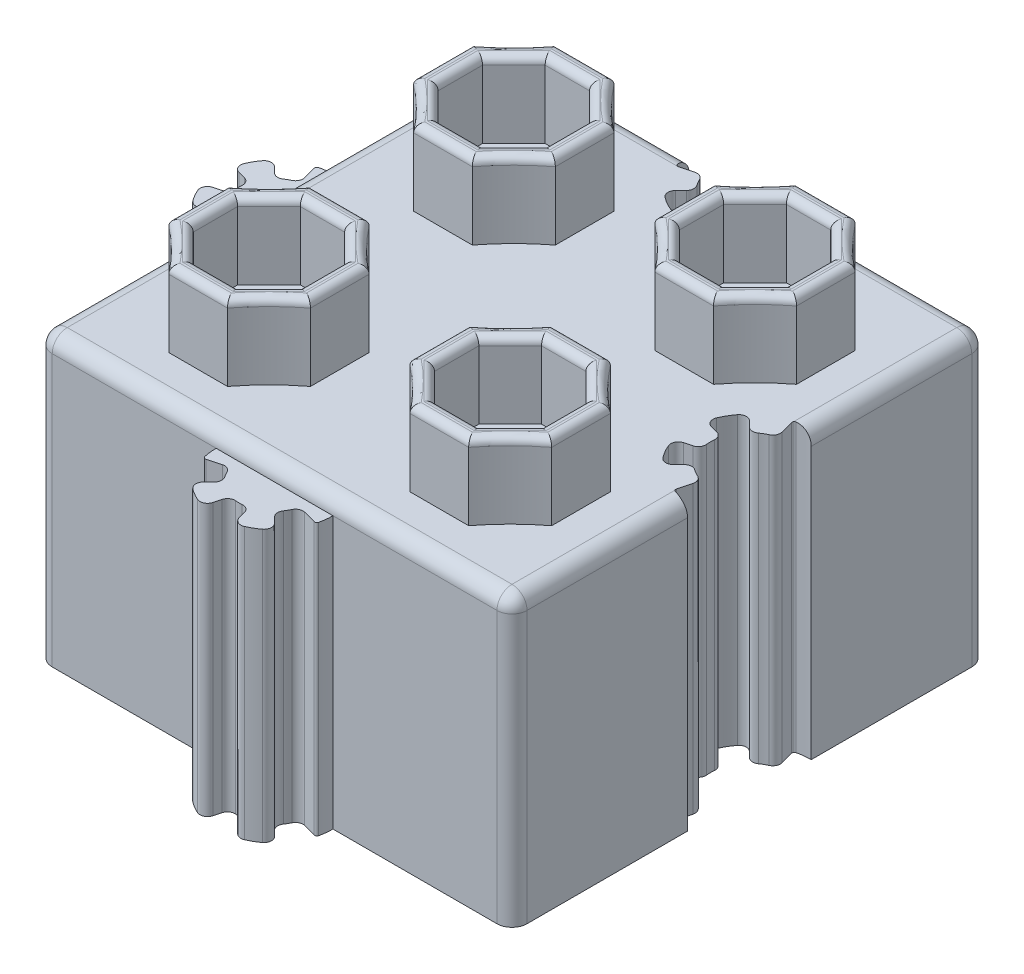
from build123d import *

# Parameters (mm, degrees)
SKETCH2_W                = 31.5
SKETCH2_H                = 31.5
BOSS_EXTRUDE1_DEPTH      = 19
CUT_EXTRUDE6_DEPTH       = 30.276697218
FILLET20_R               = 1
BOSS_EXTRUDE7_START      = -1
BOSS_EXTRUDE7_DEPTH      = 18
CUT_EXTRUDE13_DEPTH      = 2
CUT_EXTRUDE13_DEPTH_BACK = 1.5
BOSS_EXTRUDE11_DEPTH     = 5
FILLET33_R               = 0.5
CUT_EXTRUDE14_DEPTH      = 15
SKETCH18_W               = 1.2
SKETCH18_H               = 1.5
CUT_EXTRUDE15_DEPTH      = 0.025
CUT_EXTRUDE16_START      = -1.5
CUT_EXTRUDE16_DEPTH      = 1.5
FILLET34_R               = 0.5
FILLET35_START           = -1
FILLET35_DEPTH           = 16
FILLET42_R               = 0.5
FILLET43_R               = 0.15


with BuildPart() as part:
    # Sketch2 → Boss-Extrude1 (new body)
    with BuildSketch(Plane(origin=(0, 0, 0), x_dir=(1, 0, 0), z_dir=(0, 1, 0))):
        Rectangle(SKETCH2_W, SKETCH2_H)
    extrude(amount=BOSS_EXTRUDE1_DEPTH)

    # Sketch5 → Cut-Extrude6 (cut, through all)
    with BuildSketch(Plane(origin=(0, 19, 0), x_dir=(1, 0, 0), z_dir=(0, 1, 0))):
        with BuildLine():
            ThreePointArc((-0.647047613, 13.335185434), (0, 13.25), (0.647047613, 13.335185434))
            Line((0.647047613, 13.335185434), (1.03527618, 11.886296695))
            ThreePointArc((1.03527618, 11.886296695), (2, 12.285898385), (2.828427125, 12.921572875))
            Line((2.828427125, 12.921572875), (1.767766953, 13.982233047))
            ThreePointArc((1.767766953, 13.982233047), (2.165063509, 14.5), (2.414814566, 15.102952387))
            Line((2.414814566, 15.102952387), (3.863703305, 14.71472382))
            ThreePointArc((3.863703305, 14.71472382), (3.965779445, 15.227895231), (4, 15.75))
            Line((4, 15.75), (0, 15.75))
            Line((0, 15.75), (-4, 15.75))
            ThreePointArc((-4, 15.75), (-3.965779445, 15.227895231), (-3.863703305, 14.71472382))
            Line((-3.863703305, 14.71472382), (-2.414814566, 15.102952387))
            ThreePointArc((-2.414814566, 15.102952387), (-2.165063509, 14.5), (-1.767766953, 13.982233047))
            Line((-1.767766953, 13.982233047), (-2.828427125, 12.921572875))
            ThreePointArc((-2.828427125, 12.921572875), (-2, 12.285898385), (-1.03527618, 11.886296695))
            Line((-1.03527618, 11.886296695), (-0.647047613, 13.335185434))
        make_face()
        with BuildLine():
            Line((15.75, 2.6), (15.75, 4.1))
            ThreePointArc((15.75, 4.1), (15.214842612, 4.064923932), (14.688841915, 3.960295888))
            Line((14.688841915, 3.960295888), (15.077070483, 2.511407148))
            ThreePointArc((15.077070483, 2.511407148), (14.45, 2.25166605), (13.911522369, 1.838477631))
            Line((13.911522369, 1.838477631), (12.850862197, 2.899137803))
            ThreePointArc((12.850862197, 2.899137803), (12.199295844, 2.05), (11.789704112, 1.061158085))
            Line((11.789704112, 1.061158085), (13.238592852, 0.672929517))
            ThreePointArc((13.238592852, 0.672929517), (13.15, 0), (13.238592852, -0.672929517))
            Line((13.238592852, -0.672929517), (11.789704112, -1.061158085))
            ThreePointArc((11.789704112, -1.061158085), (12.199295844, -2.05), (12.850862197, -2.899137803))
            Line((12.850862197, -2.899137803), (13.911522369, -1.838477631))
            ThreePointArc((13.911522369, -1.838477631), (14.45, -2.25166605), (15.077070483, -2.511407148))
            Line((15.077070483, -2.511407148), (14.688841915, -3.960295888))
            ThreePointArc((14.688841915, -3.960295888), (15.214842612, -4.064923932), (15.75, -4.1))
            Line((15.75, -4.1), (15.75, -2.6))
            Line((15.75, -2.6), (15.75, 2.6))
        make_face()
    extrude(amount=-CUT_EXTRUDE6_DEPTH, mode=Mode.SUBTRACT)

    # Fillet20
    fillet20_edges = [part.edges().sort_by_distance(p)[0] for p in [
        (-15.75, 19, 0),
        (0, 19, 15.75),
        (15.75, 19, -9.925),
        (-9.875, 19, -15.75),
        (15.75, 19, 9.925),
        (15.75, 9.5, 15.75),
        (-15.75, 9.5, 15.75),
        (-15.75, 9.5, -15.75),
        (15.75, 9.5, -15.75),
        (9.875, 19, -15.75),
    ]]
    fillet(fillet20_edges, radius=FILLET20_R)

    # Sketch6 → Boss-Extrude7 (add, through all)
    with BuildSketch(Plane(origin=(0, 19, 0), x_dir=(1, 0, 0), z_dir=(0, 1, 0)).offset(BOSS_EXTRUDE7_START)):
        with BuildLine():
            Line((-3.742962577, -16.7529238), (-2.294073837, -16.364695232))
            ThreePointArc((-2.294073837, -16.364695232), (-2.056810334, -16.9375), (-1.679378605, -17.429378605))
            Line((-1.679378605, -17.429378605), (-2.740038777, -18.490038777))
            ThreePointArc((-2.740038777, -18.490038777), (-1.941459281, -19.103559431), (-1.011756018, -19.490584815))
            Line((-1.011756018, -19.490584815), (-0.620108527, -18.0426165))
            ThreePointArc((-0.620108527, -18.0426165), (0, -18.125), (0.620108527, -18.0426165))
            Line((0.620108527, -18.0426165), (1.011756018, -19.490584815))
            ThreePointArc((1.011756018, -19.490584815), (1.941459281, -19.103559431), (2.740038777, -18.490038777))
            Line((2.740038777, -18.490038777), (1.679378605, -17.429378605))
            ThreePointArc((1.679378605, -17.429378605), (2.056810334, -16.9375), (2.294073837, -16.364695232))
            Line((2.294073837, -16.364695232), (3.742962577, -16.7529238))
            ThreePointArc((3.742962577, -16.7529238), (3.841848838, -16.255788995), (3.875, -15.75))
            Line((3.875, -15.75), (-3.875, -15.75))
            ThreePointArc((-3.875, -15.75), (-3.841848838, -16.255788995), (-3.742962577, -16.7529238))
        make_face()
        with BuildLine():
            Line((-15.75, -3.875), (-15.75, 3.875))
            ThreePointArc((-15.75, 3.875), (-16.255788995, 3.841848838), (-16.7529238, 3.742962577))
            Line((-16.7529238, 3.742962577), (-16.364695232, 2.294073837))
            ThreePointArc((-16.364695232, 2.294073837), (-16.9375, 2.056810334), (-17.429378605, 1.679378605))
            Line((-17.429378605, 1.679378605), (-18.490038777, 2.740038777))
            ThreePointArc((-18.490038777, 2.740038777), (-19.10584844, 1.9375), (-19.492962577, 1.0029238))
            Line((-19.492962577, 1.0029238), (-18.044073837, 0.614695232))
            ThreePointArc((-18.044073837, 0.614695232), (-18.125, 0), (-18.044073837, -0.614695232))
            Line((-18.044073837, -0.614695232), (-19.492962577, -1.0029238))
            ThreePointArc((-19.492962577, -1.0029238), (-19.10584844, -1.9375), (-18.490038777, -2.740038777))
            Line((-18.490038777, -2.740038777), (-17.429378605, -1.679378605))
            ThreePointArc((-17.429378605, -1.679378605), (-16.9375, -2.056810334), (-16.364695232, -2.294073837))
            Line((-16.364695232, -2.294073837), (-16.7529238, -3.742962577))
            ThreePointArc((-16.7529238, -3.742962577), (-16.255788995, -3.841848838), (-15.75, -3.875))
        make_face()
    extrude(amount=-BOSS_EXTRUDE7_DEPTH)

    # Sketch16 → Cut-Extrude13 (cut, two sides: drawn at the far end of the back side and taken through both)
    with BuildSketch(Plane.XZ.offset(-CUT_EXTRUDE13_DEPTH_BACK)):
        with BuildLine():
            Line((-14.3, 14.3), (-8.175, 14.3))
            Line((-8.175, 14.3), (-8.175, 12.6))
            ThreePointArc((-8.175, 12.6), (-8.145710678, 12.529289322), (-8.075, 12.5))
            Line((-8.075, 12.5), (-6.825, 12.5))
            ThreePointArc((-6.825, 12.5), (-6.754289322, 12.529289322), (-6.725, 12.6))
            Line((-6.725, 12.6), (-6.725, 14.3))
            Line((-6.725, 14.3), (6.721665956, 14.3))
            Line((6.721665956, 14.3), (6.721665956, 12.6))
            ThreePointArc((6.721665956, 12.6), (6.750955278, 12.529289322), (6.821665956, 12.5))
            Line((6.821665956, 12.5), (8.071665956, 12.5))
            ThreePointArc((8.071665956, 12.5), (8.142376634, 12.529289322), (8.171665956, 12.6))
            Line((8.171665956, 12.6), (8.171665956, 14.3))
            Line((8.171665956, 14.3), (14.3, 14.3))
            Line((14.3, 14.3), (14.3, 8.175))
            Line((14.3, 8.175), (12.6, 8.175))
            ThreePointArc((12.6, 8.175), (12.529289322, 8.145710678), (12.5, 8.075))
            Line((12.5, 8.075), (12.5, 6.825))
            ThreePointArc((12.5, 6.825), (12.529289322, 6.754289322), (12.6, 6.725))
            Line((12.6, 6.725), (14.3, 6.725))
            Line((14.3, 6.725), (14.3, 4.623310502))
            ThreePointArc((14.3, 4.623310502), (11.956404012, 3.135991924), (10.82799643, 0.6))
            ThreePointArc((10.82799643, 0.6), (10.782740417, 0), (10.82799643, -0.6))
            ThreePointArc((10.82799643, -0.6), (11.956404012, -3.135991924), (14.3, -4.623310502))
            Line((14.3, -4.623310502), (14.3, -6.725))
            Line((14.3, -6.725), (12.6, -6.725))
            ThreePointArc((12.6, -6.725), (12.529289322, -6.754289322), (12.5, -6.825))
            Line((12.5, -6.825), (12.5, -8.075))
            ThreePointArc((12.5, -8.075), (12.529289322, -8.145710678), (12.6, -8.175))
            Line((12.6, -8.175), (14.3, -8.175))
            Line((14.3, -8.175), (14.3, -14.3))
            Line((14.3, -14.3), (8.35038088, -14.3))
            Line((8.35038088, -14.3), (8.171665956, -14.3))
            Line((8.171665956, -14.3), (8.171665956, -12.6))
            ThreePointArc((8.171665956, -12.6), (8.142376634, -12.529289322), (8.071665956, -12.5))
            Line((8.071665956, -12.5), (6.821665956, -12.5))
            ThreePointArc((6.821665956, -12.5), (6.750955278, -12.529289322), (6.721665956, -12.6))
            Line((6.721665956, -12.6), (6.721665956, -14.3))
            Line((6.721665956, -14.3), (4.623310502, -14.3))
            Line((4.623310502, -14.3), (4.575751304, -14.3))
            ThreePointArc((4.575751304, -14.3), (3.072656017, -12.062346952), (0.600502286, -10.987710949))
            ThreePointArc((0.600502286, -10.987710949), (-0.001645996, -10.942336934), (-0.603763067, -10.988123252))
            ThreePointArc((-0.603763067, -10.988123252), (-3.073918375, -12.063399151), (-4.575751304, -14.3))
            Line((-4.575751304, -14.3), (-4.623310502, -14.3))
            Line((-4.623310502, -14.3), (-6.725, -14.3))
            Line((-6.725, -14.3), (-6.725, -12.6))
            ThreePointArc((-6.725, -12.6), (-6.754289322, -12.529289322), (-6.825, -12.5))
            Line((-6.825, -12.5), (-8.075, -12.5))
            ThreePointArc((-8.075, -12.5), (-8.145710678, -12.529289322), (-8.175, -12.6))
            Line((-8.175, -12.6), (-8.175, -14.3))
            Line((-8.175, -14.3), (-14.3, -14.3))
            Line((-14.3, -14.3), (-14.3, -8.175))
            Line((-14.3, -8.175), (-12.6, -8.175))
            ThreePointArc((-12.6, -8.175), (-12.529289322, -8.145710678), (-12.5, -8.075))
            Line((-12.5, -8.075), (-12.5, -6.825))
            ThreePointArc((-12.5, -6.825), (-12.529289322, -6.754289322), (-12.6, -6.725))
            Line((-12.6, -6.725), (-14.3, -6.725))
            Line((-14.3, -6.725), (-14.3, 6.725))
            Line((-14.3, 6.725), (-12.6, 6.725))
            ThreePointArc((-12.6, 6.725), (-12.529289322, 6.754289322), (-12.5, 6.825))
            Line((-12.5, 6.825), (-12.5, 8.075))
            ThreePointArc((-12.5, 8.075), (-12.529289322, 8.145710678), (-12.6, 8.175))
            Line((-12.6, 8.175), (-14.3, 8.175))
            Line((-14.3, 8.175), (-14.3, 14.3))
        make_face()
    extrude(amount=CUT_EXTRUDE13_DEPTH + CUT_EXTRUDE13_DEPTH_BACK, mode=Mode.SUBTRACT)

    # Sketch3 → Boss-Extrude11 (add)
    # profile 1 of 4: a face of its own
    with BuildSketch(Plane(origin=(0, 19, 0), x_dir=(1, 0, 0), z_dir=(0, 1, 0))):
        with BuildLine():
            ThreePointArc((-9.946803743, 3.421093296), (-11.233690264, 4.887403031), (-12.7, 6.174289552))
            Line((-12.7, 6.174289552), (-12.7, 10.067897039))
            ThreePointArc((-12.7, 10.067897039), (-11.233690264, 11.35478356), (-9.946803743, 12.821093296))
            Line((-9.946803743, 12.821093296), (-6.053196257, 12.821093296))
            ThreePointArc((-6.053196257, 12.821093296), (-4.766309736, 11.35478356), (-3.3, 10.067897039))
            Line((-3.3, 10.067897039), (-3.3, 6.174289552))
            ThreePointArc((-3.3, 6.174289552), (-4.766309736, 4.887403031), (-6.053196257, 3.421093296))
            Line((-6.053196257, 3.421093296), (-9.946803743, 3.421093296))
        make_face()
        Polygon((-9.470458146, 4.571093296), (-6.529541854, 4.571093296), (-4.45, 6.650635149), (-4.45, 9.591551442), (-6.529541854, 11.671093296), (-9.470458146, 11.671093296), (-11.55, 9.591551442), (-11.55, 6.650635149), align=None, mode=Mode.SUBTRACT)
    # profile 2 of 4: a face of its own
    with BuildSketch(Plane(origin=(0, 19, 0), x_dir=(1, 0, 0), z_dir=(0, 1, 0))):
        with BuildLine():
            Line((12.7, 10.067897039), (12.7, 6.174289552))
            ThreePointArc((12.7, 6.174289552), (11.233690264, 4.887403031), (9.946803743, 3.421093296))
            Line((9.946803743, 3.421093296), (6.053196257, 3.421093296))
            ThreePointArc((6.053196257, 3.421093296), (4.766309736, 4.887403031), (3.3, 6.174289552))
            Line((3.3, 6.174289552), (3.3, 10.067897039))
            ThreePointArc((3.3, 10.067897039), (4.766309736, 11.35478356), (6.053196257, 12.821093296))
            Line((6.053196257, 12.821093296), (9.946803743, 12.821093296))
            ThreePointArc((9.946803743, 12.821093296), (11.233690264, 11.35478356), (12.7, 10.067897039))
        make_face()
        Polygon((9.470458146, 4.571093296), (6.529541854, 4.571093296), (4.45, 6.650635149), (4.45, 9.591551442), (6.529541854, 11.671093296), (9.470458146, 11.671093296), (11.55, 9.591551442), (11.55, 6.650635149), align=None, mode=Mode.SUBTRACT)
    # profile 3 of 4: a face of its own
    with BuildSketch(Plane(origin=(0, 19, 0), x_dir=(1, 0, 0), z_dir=(0, 1, 0))):
        with BuildLine():
            ThreePointArc((9.946803743, -3.421093296), (11.233690264, -4.887403031), (12.7, -6.174289552))
            Line((12.7, -6.174289552), (12.7, -10.067897039))
            ThreePointArc((12.7, -10.067897039), (11.233690264, -11.35478356), (9.946803743, -12.821093296))
            Line((9.946803743, -12.821093296), (6.053196257, -12.821093296))
            ThreePointArc((6.053196257, -12.821093296), (4.766309736, -11.35478356), (3.3, -10.067897039))
            Line((3.3, -10.067897039), (3.3, -6.174289552))
            ThreePointArc((3.3, -6.174289552), (4.766309736, -4.887403031), (6.053196257, -3.421093296))
            Line((6.053196257, -3.421093296), (9.946803743, -3.421093296))
        make_face()
        Polygon((9.470458146, -4.571093296), (6.529541854, -4.571093296), (4.45, -6.650635149), (4.45, -9.591551442), (6.529541854, -11.671093296), (9.470458146, -11.671093296), (11.55, -9.591551442), (11.55, -6.650635149), align=None, mode=Mode.SUBTRACT)
    # profile 4 of 4: a face of its own
    with BuildSketch(Plane(origin=(0, 19, 0), x_dir=(1, 0, 0), z_dir=(0, 1, 0))):
        with BuildLine():
            Line((-12.7, -10.067897039), (-12.7, -6.174289552))
            ThreePointArc((-12.7, -6.174289552), (-11.233690264, -4.887403031), (-9.946803743, -3.421093296))
            Line((-9.946803743, -3.421093296), (-6.053196257, -3.421093296))
            ThreePointArc((-6.053196257, -3.421093296), (-4.766309736, -4.887403031), (-3.3, -6.174289552))
            Line((-3.3, -6.174289552), (-3.3, -10.067897039))
            ThreePointArc((-3.3, -10.067897039), (-4.766309736, -11.35478356), (-6.053196257, -12.821093296))
            Line((-6.053196257, -12.821093296), (-9.946803743, -12.821093296))
            ThreePointArc((-9.946803743, -12.821093296), (-11.233690264, -11.35478356), (-12.7, -10.067897039))
        make_face()
        Polygon((-9.470458146, -4.571093296), (-6.529541854, -4.571093296), (-4.45, -6.650635149), (-4.45, -9.591551442), (-6.529541854, -11.671093296), (-9.470458146, -11.671093296), (-11.55, -9.591551442), (-11.55, -6.650635149), align=None, mode=Mode.SUBTRACT)
    extrude(amount=BOSS_EXTRUDE11_DEPTH)

    # Fillet33
    fillet33_edges = [part.edges().sort_by_distance(p)[0] for p in [
        (-8, 24, -4.571093296),
        (-10.510229073, 24, -5.610864222),
        (-11.55, 24, -8.121093296),
        (-10.510229073, 24, -10.631322369),
        (-8, 24, -11.671093296),
        (-5.489770927, 24, -10.631322369),
        (-4.45, 24, -8.121093296),
        (-11.233690264, 24, -4.887403031),
        (-4.766309736, 24, -11.35478356),
        (-11.233690264, 24, -11.35478356),
        (-5.489770927, 24, -5.610864222),
        (-8, 24, -3.421093296),
        (-4.766309736, 24, -4.887403031),
        (-3.3, 24, -8.121093296),
        (-8, 24, -12.821093296),
        (-12.7, 24, -8.121093296),
        (12.7, 24, -8.121093296),
        (8, 24, -12.821093296),
        (3.3, 24, -8.121093296),
        (4.766309736, 24, -4.887403031),
        (8, 24, -3.421093296),
        (8, 24, -4.571093296),
        (5.489770927, 24, -5.610864222),
        (4.45, 24, -8.121093296),
        (5.489770927, 24, -10.631322369),
        (8, 24, -11.671093296),
        (10.510229073, 24, -10.631322369),
        (11.55, 24, -8.121093296),
        (10.510229073, 24, -5.610864222),
        (11.233690264, 24, -11.35478356),
        (4.766309736, 24, -11.35478356),
        (11.233690264, 24, -4.887403031),
        (8, 24, 4.571093296),
        (10.510229073, 24, 5.610864222),
        (11.55, 24, 8.121093296),
        (10.510229073, 24, 10.631322369),
        (8, 24, 11.671093296),
        (5.489770927, 24, 10.631322369),
        (4.45, 24, 8.121093296),
        (11.233690264, 24, 4.887403031),
        (4.766309736, 24, 11.35478356),
        (11.233690264, 24, 11.35478356),
        (5.489770927, 24, 5.610864222),
        (8, 24, 3.421093296),
        (4.766309736, 24, 4.887403031),
        (3.3, 24, 8.121093296),
        (8, 24, 12.821093296),
        (12.7, 24, 8.121093296),
        (-12.7, 24, 8.121093296),
        (-8, 24, 12.821093296),
        (-3.3, 24, 8.121093296),
        (-4.766309736, 24, 4.887403031),
        (-8, 24, 3.421093296),
        (-8, 24, 4.571093296),
        (-5.489770927, 24, 5.610864222),
        (-4.45, 24, 8.121093296),
        (-5.489770927, 24, 10.631322369),
        (-8, 24, 11.671093296),
        (-10.510229073, 24, 10.631322369),
        (-11.55, 24, 8.121093296),
        (-10.510229073, 24, 5.610864222),
        (-11.233690264, 24, 11.35478356),
        (-4.766309736, 24, 11.35478356),
        (-11.233690264, 24, 4.887403031),
    ]]
    fillet(fillet33_edges, radius=FILLET33_R)

    # Sketch7 → Cut-Extrude14 (cut)
    with BuildSketch(Plane.XZ):
        with BuildLine():
            ThreePointArc((-4.259988263, -14.3), (-2.859722023, -12.275523068), (-0.603763067, -11.290687255))
            Line((-0.603763067, -11.290687255), (-0.603763067, -4.963413156))
            ThreePointArc((-0.603763067, -4.963413156), (-1.845028292, -4.647135742), (-2.965202778, -4.025862949))
            Line((-2.965202778, -4.025862949), (-3.959797975, -5.020458146))
            Line((-3.959797975, -5.020458146), (-5.020458146, -3.959797975))
            Line((-5.020458146, -3.959797975), (-4.027923069, -2.962403712))
            ThreePointArc((-4.027923069, -2.962403712), (-4.64847513, -1.841651151), (-4.963869458, -0.6))
            Line((-4.963869458, -0.6), (-14.325, -0.6))
            Line((-14.325, -0.6), (-14.325, -6.725))
            Line((-14.325, -6.725), (-12.675, -6.725))
            Line((-12.675, -6.725), (-12.675, -7.3))
            Line((-12.675, -7.3), (-14.325, -7.3))
            Line((-14.325, -7.3), (-14.325, -14.3))
            Line((-14.325, -14.3), (-7.325, -14.3))
            Line((-7.325, -14.3), (-7.325, -12.65))
            Line((-7.325, -12.65), (-6.725, -12.65))
            Line((-6.725, -12.65), (-6.725, -14.3))
            Line((-6.725, -14.3), (-4.259988263, -14.3))
        make_face()
        with BuildLine():
            ThreePointArc((14.3, -4.259988263), (12.274316834, -2.858255854), (11.290179376, -0.6))
            Line((11.290179376, -0.6), (4.963869458, -0.6))
            ThreePointArc((4.963869458, -0.6), (4.64847513, -1.841651151), (4.027923069, -2.962403712))
            Line((4.027923069, -2.962403712), (5.020458146, -3.959797975))
            Line((5.020458146, -3.959797975), (3.959797975, -5.020458146))
            Line((3.959797975, -5.020458146), (2.965202778, -4.025862949))
            ThreePointArc((2.965202778, -4.025862949), (1.843266601, -4.64783479), (0.6, -4.963869458))
            Line((0.6, -4.963869458), (0.6, -11.290179376))
            ThreePointArc((0.6, -11.290179376), (2.86843208, -12.282710367), (4.268415983, -14.325))
            Line((4.268415983, -14.325), (6.7, -14.325))
            Line((6.7, -14.325), (6.7, -12.525))
            Line((6.7, -12.525), (7.3, -12.525))
            Line((7.3, -12.525), (7.3, -14.325))
            Line((7.3, -14.325), (14.3, -14.325))
            Line((14.3, -14.325), (14.3, -7.325))
            Line((14.3, -7.325), (12.65, -7.325))
            Line((12.65, -7.325), (12.65, -6.725))
            Line((12.65, -6.725), (14.3, -6.725))
            Line((14.3, -6.725), (14.3, -4.259988263))
        make_face()
        with BuildLine():
            Line((7.571665956, 14.3), (0.6, 14.3))
            Line((0.6, 14.3), (0.6, 4.963869458))
            ThreePointArc((0.6, 4.963869458), (1.843266601, 4.64783479), (2.965202778, 4.025862949))
            Line((2.965202778, 4.025862949), (3.959797975, 5.020458146))
            Line((3.959797975, 5.020458146), (5.020458146, 3.959797975))
            Line((5.020458146, 3.959797975), (4.027923069, 2.962403712))
            ThreePointArc((4.027923069, 2.962403712), (4.64847513, 1.841651151), (4.963869458, 0.6))
            Line((4.963869458, 0.6), (11.290179376, 0.6))
            ThreePointArc((11.290179376, 0.6), (12.274316834, 2.858255854), (14.3, 4.259988263))
            Line((14.3, 4.259988263), (14.3, 6.7))
            Line((14.3, 6.7), (12.5, 6.7))
            Line((12.5, 6.7), (12.5, 7.3))
            Line((12.5, 7.3), (14.3, 7.3))
            Line((14.3, 7.3), (14.3, 14.3))
            Line((14.3, 14.3), (8.171665956, 14.3))
            Line((8.171665956, 14.3), (8.171665956, 12.65))
            Line((8.171665956, 12.65), (7.571665956, 12.65))
            Line((7.571665956, 12.65), (7.571665956, 14.3))
        make_face()
        with BuildLine():
            Line((-7.325, 14.3), (-14.325, 14.3))
            Line((-14.325, 14.3), (-14.325, 7.3))
            Line((-14.325, 7.3), (-12.525, 7.3))
            Line((-12.525, 7.3), (-12.525, 6.7))
            Line((-12.525, 6.7), (-14.325, 6.7))
            Line((-14.325, 6.7), (-14.325, 0.6))
            Line((-14.325, 0.6), (-4.963869458, 0.6))
            ThreePointArc((-4.963869458, 0.6), (-4.64847513, 1.841651151), (-4.027923069, 2.962403712))
            Line((-4.027923069, 2.962403712), (-5.020458146, 3.959797975))
            Line((-5.020458146, 3.959797975), (-3.959797975, 5.020458146))
            Line((-3.959797975, 5.020458146), (-2.965202778, 4.025862949))
            ThreePointArc((-2.965202778, 4.025862949), (-1.845028292, 4.647135742), (-0.603763067, 4.963413156))
            Line((-0.603763067, 4.963413156), (-0.603763067, 14.3))
            Line((-0.603763067, 14.3), (-6.725, 14.3))
            Line((-6.725, 14.3), (-6.725, 12.65))
            Line((-6.725, 12.65), (-7.325, 12.65))
            Line((-7.325, 12.65), (-7.325, 14.3))
        make_face()
        with BuildLine():
            ThreePointArc((2.828427125, 2.828427125), (2, 3.464101615), (1.03527618, 3.863703305))
            Line((1.03527618, 3.863703305), (0.647047613, 2.414814566))
            ThreePointArc((0.647047613, 2.414814566), (0, 2.5), (-0.647047613, 2.414814566))
            Line((-0.647047613, 2.414814566), (-1.03527618, 3.863703305))
            ThreePointArc((-1.03527618, 3.863703305), (-2, 3.464101615), (-2.828427125, 2.828427125))
            Line((-2.828427125, 2.828427125), (-1.767766953, 1.767766953))
            ThreePointArc((-1.767766953, 1.767766953), (-2.165063509, 1.25), (-2.414814566, 0.647047613))
            Line((-2.414814566, 0.647047613), (-3.863703305, 1.03527618))
            ThreePointArc((-3.863703305, 1.03527618), (-4, 0), (-3.863703305, -1.03527618))
            Line((-3.863703305, -1.03527618), (-2.414814566, -0.647047613))
            ThreePointArc((-2.414814566, -0.647047613), (-2.165063509, -1.25), (-1.767766953, -1.767766953))
            Line((-1.767766953, -1.767766953), (-2.828427125, -2.828427125))
            ThreePointArc((-2.828427125, -2.828427125), (-2, -3.464101615), (-1.03527618, -3.863703305))
            Line((-1.03527618, -3.863703305), (-0.647047613, -2.414814566))
            ThreePointArc((-0.647047613, -2.414814566), (0, -2.5), (0.647047613, -2.414814566))
            Line((0.647047613, -2.414814566), (1.03527618, -3.863703305))
            ThreePointArc((1.03527618, -3.863703305), (2, -3.464101615), (2.828427125, -2.828427125))
            Line((2.828427125, -2.828427125), (1.767766953, -1.767766953))
            ThreePointArc((1.767766953, -1.767766953), (2.165063509, -1.25), (2.414814566, -0.647047613))
            Line((2.414814566, -0.647047613), (3.863703305, -1.03527618))
            ThreePointArc((3.863703305, -1.03527618), (4, 0), (3.863703305, 1.03527618))
            Line((3.863703305, 1.03527618), (2.414814566, 0.647047613))
            ThreePointArc((2.414814566, 0.647047613), (2.165063509, 1.25), (1.767766953, 1.767766953))
            Line((1.767766953, 1.767766953), (2.828427125, 2.828427125))
        make_face()
    extrude(amount=-CUT_EXTRUDE14_DEPTH, mode=Mode.SUBTRACT)

    # Sketch18 → Cut-Extrude15 (cut)
    with BuildSketch(Plane(origin=(-14.3, 0, 0), x_dir=(0, 0, -1), z_dir=(1, 0, 0))):
        with Locations((0, 0.75)):
            Rectangle(SKETCH18_W, SKETCH18_H)
    extrude(amount=-CUT_EXTRUDE15_DEPTH, mode=Mode.SUBTRACT)

    # Sketch19 → Cut-Extrude16 (cut)
    with BuildSketch(Plane.XZ.offset(CUT_EXTRUDE16_START)):
        with BuildLine():
            Line((-0.603763067, -11.290687255), (-0.603763067, -10.988123252))
            ThreePointArc((-0.603763067, -10.988123252), (-0.001900018, -10.942337029), (0.6, -10.987634675))
            Line((0.6, -10.987634675), (0.6, -11.290179376))
            ThreePointArc((0.6, -11.290179376), (-0.001900748, -11.24489138), (-0.603763067, -11.290687255))
        make_face()
        with BuildLine():
            Line((11.290179376, 0.6), (10.82799643, 0.6))
            ThreePointArc((10.82799643, 0.6), (10.782740417, 0), (10.82799643, -0.6))
            Line((10.82799643, -0.6), (11.290179376, -0.6))
            ThreePointArc((11.290179376, -0.6), (11.244923362, 0), (11.290179376, 0.6))
        make_face()
    extrude(amount=CUT_EXTRUDE16_DEPTH, mode=Mode.SUBTRACT)

    # Fillet34
    fillet34_edges = [part.edges().sort_by_distance(p)[0] for p in [
        (-1.767766953, 8.25, 1.767766953),
        (-2.828427125, 8.25, 2.828427125),
        (-1.03527618, 8.25, 3.863703305),
        (-0.647047613, 8.25, 2.414814566),
        (0.647047613, 8.25, 2.414814566),
        (1.03527618, 8.25, 3.863703305),
        (2.828427125, 8.25, 2.828427125),
        (1.767766953, 8.25, 1.767766953),
        (2.414814566, 8.25, 0.647047613),
        (3.863703305, 8.25, 1.03527618),
        (3.863703305, 8.25, -1.03527618),
        (2.414814566, 8.25, -0.647047613),
        (1.767766953, 8.25, -1.767766953),
        (2.828427125, 8.25, -2.828427125),
        (1.03527618, 8.25, -3.863703305),
        (0.647047613, 8.25, -2.414814566),
        (-0.647047613, 8.25, -2.414814566),
        (-1.03527618, 8.25, -3.863703305),
        (-2.828427125, 8.25, -2.828427125),
        (-1.767766953, 8.25, -1.767766953),
        (-2.414814566, 8.25, -0.647047613),
        (-3.863703305, 8.25, -1.03527618),
        (-3.863703305, 8.25, 1.03527618),
        (-2.414814566, 8.25, 0.647047613),
    ]]
    fillet(fillet34_edges, radius=FILLET34_R)

    # Fillet35: read off the stored shape, not the designer's step
    # Fillet35 outline → Fillet35 (cut)
    with BuildSketch(Plane(origin=(0, 0, 0), x_dir=(1, 0, 0), z_dir=(0, 1, 0)).offset(FILLET35_START)):
        with BuildLine():
            Line((-5.020458146, -3.959797975), (-4.879381704, -4.100874417))
            ThreePointArc((-4.879381704, -4.100874417), (-4.937960198, -3.959697249), (-4.879726616, -3.818377461))
            Line((-4.879726616, -3.818377461), (-5.020458146, -3.959797975))
        make_face()
        with BuildLine():
            ThreePointArc((-3.818376618, -4.87903679), (-3.959797974, -4.937615434), (-4.101219331, -4.87903679))
            Line((-4.101219331, -4.87903679), (-3.959797975, -5.020458146))
            Line((-3.959797975, -5.020458146), (-3.818376618, -4.87903679))
        make_face()
        with BuildLine():
            Line((3.959797975, -5.020458146), (4.101219331, -4.87903679))
            ThreePointArc((4.101219331, -4.87903679), (3.959797974, -4.937615434), (3.818376618, -4.87903679))
            Line((3.818376618, -4.87903679), (3.959797975, -5.020458146))
        make_face()
        with BuildLine():
            ThreePointArc((4.879726616, -3.818377461), (4.937960198, -3.959697249), (4.879381704, -4.100874417))
            Line((4.879381704, -4.100874417), (5.020458146, -3.959797975))
            Line((5.020458146, -3.959797975), (4.879726616, -3.818377461))
        make_face()
        with BuildLine():
            Line((5.020458146, 3.959797975), (4.879381704, 4.100874417))
            ThreePointArc((4.879381704, 4.100874417), (4.937960198, 3.959697249), (4.879726616, 3.818377461))
            Line((4.879726616, 3.818377461), (5.020458146, 3.959797975))
        make_face()
        with BuildLine():
            ThreePointArc((3.818376618, 4.87903679), (3.959797974, 4.937615434), (4.101219331, 4.87903679))
            Line((4.101219331, 4.87903679), (3.959797975, 5.020458146))
            Line((3.959797975, 5.020458146), (3.818376618, 4.87903679))
        make_face()
        with BuildLine():
            Line((-3.959797975, 5.020458146), (-4.101219331, 4.87903679))
            ThreePointArc((-4.101219331, 4.87903679), (-3.959797974, 4.937615434), (-3.818376618, 4.87903679))
            Line((-3.818376618, 4.87903679), (-3.959797975, 5.020458146))
        make_face()
        with BuildLine():
            ThreePointArc((-4.879726616, 3.818377461), (-4.937960198, 3.959697249), (-4.879381704, 4.100874417))
            Line((-4.879381704, 4.100874417), (-5.020458146, 3.959797975))
            Line((-5.020458146, 3.959797975), (-4.879726616, 3.818377461))
        make_face()
        with BuildLine():
            Line((-12.675, 7.3), (-12.875, 7.3))
            ThreePointArc((-12.875, 7.3), (-12.733578644, 7.241421356), (-12.675, 7.1))
            Line((-12.675, 7.1), (-12.675, 7.3))
        make_face()
        with BuildLine():
            Line((-12.675, 6.725), (-12.675, 6.925))
            ThreePointArc((-12.675, 6.925), (-12.733578644, 6.783578644), (-12.875, 6.725))
            Line((-12.875, 6.725), (-12.675, 6.725))
        make_face()
        with BuildLine():
            Line((-7.325, 12.65), (-7.125, 12.65))
            ThreePointArc((-7.125, 12.65), (-7.266421356, 12.708578644), (-7.325, 12.85))
            Line((-7.325, 12.85), (-7.325, 12.65))
        make_face()
        with BuildLine():
            ThreePointArc((-6.725, 12.85), (-6.783578644, 12.708578644), (-6.925, 12.65))
            Line((-6.925, 12.65), (-6.725, 12.65))
            Line((-6.725, 12.65), (-6.725, 12.85))
        make_face()
        with BuildLine():
            Line((6.755522173, 12.525), (6.9, 12.525))
            ThreePointArc((6.9, 12.525), (6.758578644, 12.583578644), (6.7, 12.725))
            Line((6.7, 12.725), (6.7, 12.525))
            Line((6.7, 12.525), (6.755522173, 12.525))
        make_face()
        with BuildLine():
            ThreePointArc((7.3, 12.725), (7.241421356, 12.583578644), (7.1, 12.525))
            Line((7.1, 12.525), (7.3, 12.525))
            Line((7.3, 12.525), (7.3, 12.725))
        make_face()
        with BuildLine():
            ThreePointArc((12.85, 6.725), (12.708578644, 6.783578644), (12.65, 6.925))
            Line((12.65, 6.925), (12.65, 6.725))
            Line((12.65, 6.725), (12.85, 6.725))
        make_face()
        with BuildLine():
            Line((12.65, 7.325), (12.65, 7.125))
            ThreePointArc((12.65, 7.125), (12.708578644, 7.266421356), (12.85, 7.325))
            Line((12.85, 7.325), (12.65, 7.325))
        make_face()
        with BuildLine():
            ThreePointArc((12.7, -7.3), (12.558578644, -7.241421356), (12.5, -7.1))
            Line((12.5, -7.1), (12.5, -7.3))
            Line((12.5, -7.3), (12.7, -7.3))
        make_face()
        with BuildLine():
            ThreePointArc((12.5, -6.9), (12.558578644, -6.758578644), (12.7, -6.7))
            Line((12.7, -6.7), (12.5, -6.7))
            Line((12.5, -6.7), (12.5, -6.825))
            Line((12.5, -6.825), (12.5, -6.9))
        make_face()
        with BuildLine():
            ThreePointArc((7.571665956, -12.85), (7.6302446, -12.708578644), (7.771665956, -12.65))
            Line((7.771665956, -12.65), (7.571665956, -12.65))
            Line((7.571665956, -12.65), (7.571665956, -12.85))
        make_face()
        with BuildLine():
            ThreePointArc((7.971665956, -12.65), (8.113087312, -12.708578644), (8.171665956, -12.85))
            Line((8.171665956, -12.85), (8.171665956, -12.65))
            Line((8.171665956, -12.65), (7.971665956, -12.65))
        make_face()
        with BuildLine():
            Line((-7.325, -12.65), (-7.325, -12.85))
            ThreePointArc((-7.325, -12.85), (-7.266421356, -12.708578644), (-7.125, -12.65))
            Line((-7.125, -12.65), (-7.325, -12.65))
        make_face()
        with BuildLine():
            Line((-6.725, -12.65), (-6.925, -12.65))
            ThreePointArc((-6.925, -12.65), (-6.783578644, -12.708578644), (-6.725, -12.85))
            Line((-6.725, -12.85), (-6.725, -12.65))
        make_face()
        with BuildLine():
            ThreePointArc((-12.725, -6.7), (-12.583578644, -6.758578644), (-12.525, -6.9))
            Line((-12.525, -6.9), (-12.525, -6.758856217))
            Line((-12.525, -6.758856217), (-12.525, -6.7))
            Line((-12.525, -6.7), (-12.725, -6.7))
        make_face()
        with BuildLine():
            ThreePointArc((-12.525, -7.1), (-12.583578644, -7.241421356), (-12.725, -7.3))
            Line((-12.725, -7.3), (-12.525, -7.3))
            Line((-12.525, -7.3), (-12.525, -7.1))
        make_face()
    extrude(amount=FILLET35_DEPTH, mode=Mode.SUBTRACT)

    # Fillet42
    fillet42_edges = [part.edges().sort_by_distance(p)[0] for p in [
        (-17.429378605, 9, 1.679378605),
        (-18.490038777, 9, 2.740038777),
        (-19.492962577, 9, 1.0029238),
        (-18.044073837, 9, 0.614695232),
        (-18.044073837, 9, -0.614695232),
        (-19.492962577, 9, -1.0029238),
        (-18.490038777, 9, -2.740038777),
        (-17.429378605, 9, -1.679378605),
        (-16.364695232, 9, -2.294073837),
        (-16.364695232, 9, 2.294073837),
        (0.620108527, 9, 18.0426165),
        (-0.620108527, 9, 18.0426165),
        (-1.011756018, 9, 19.490584815),
        (-2.740038777, 9, 18.490038777),
        (-1.679378605, 9, 17.429378605),
        (-2.294073837, 9, 16.364695232),
        (2.294073837, 9, 16.364695232),
        (1.679378605, 9, 17.429378605),
        (2.740038777, 9, 18.490038777),
        (1.011756018, 9, 19.490584815),
        (-0.647047613, 9.5, -13.335185434),
        (-1.03527618, 9.5, -11.886296695),
        (-2.828427125, 9.5, -12.921572875),
        (-1.767766953, 9.5, -13.982233047),
        (-2.414814566, 9.5, -15.102952387),
        (2.414814566, 9.5, -15.102952387),
        (1.767766953, 9.5, -13.982233047),
        (2.828427125, 9.5, -12.921572875),
        (1.03527618, 9.5, -11.886296695),
        (0.647047613, 9.5, -13.335185434),
        (13.911522369, 9.5, 1.838477631),
        (12.850862197, 9.5, 2.899137803),
        (11.789704112, 9.5, 1.061158085),
        (13.238592852, 9.5, 0.672929517),
        (13.238592852, 9.5, -0.672929517),
        (11.789704112, 9.5, -1.061158085),
        (12.850862197, 9.5, -2.899137803),
        (13.911522369, 9.5, -1.838477631),
        (15.077070483, 9.5, -2.511407148),
        (15.077070483, 9.5, 2.511407148),
    ]]
    fillet(fillet42_edges, radius=FILLET42_R)

    # Fillet43
    fillet43_edges = [part.edges().sort_by_distance(p)[0] for p in [
        (14.688841915, 9.5, -3.960295888),
        (14.688841915, 9.5, 3.960295888),
        (3.863703305, 9.5, -14.71472382),
        (-3.863703305, 9.5, -14.71472382),
        (3.742962577, 9, 16.7529238),
        (-3.742962577, 9, 16.7529238),
        (-16.7529238, 9, 3.742962577),
        (-16.7529238, 9, -3.742962577),
    ]]
    fillet(fillet43_edges, radius=FILLET43_R)


solid = part.part
